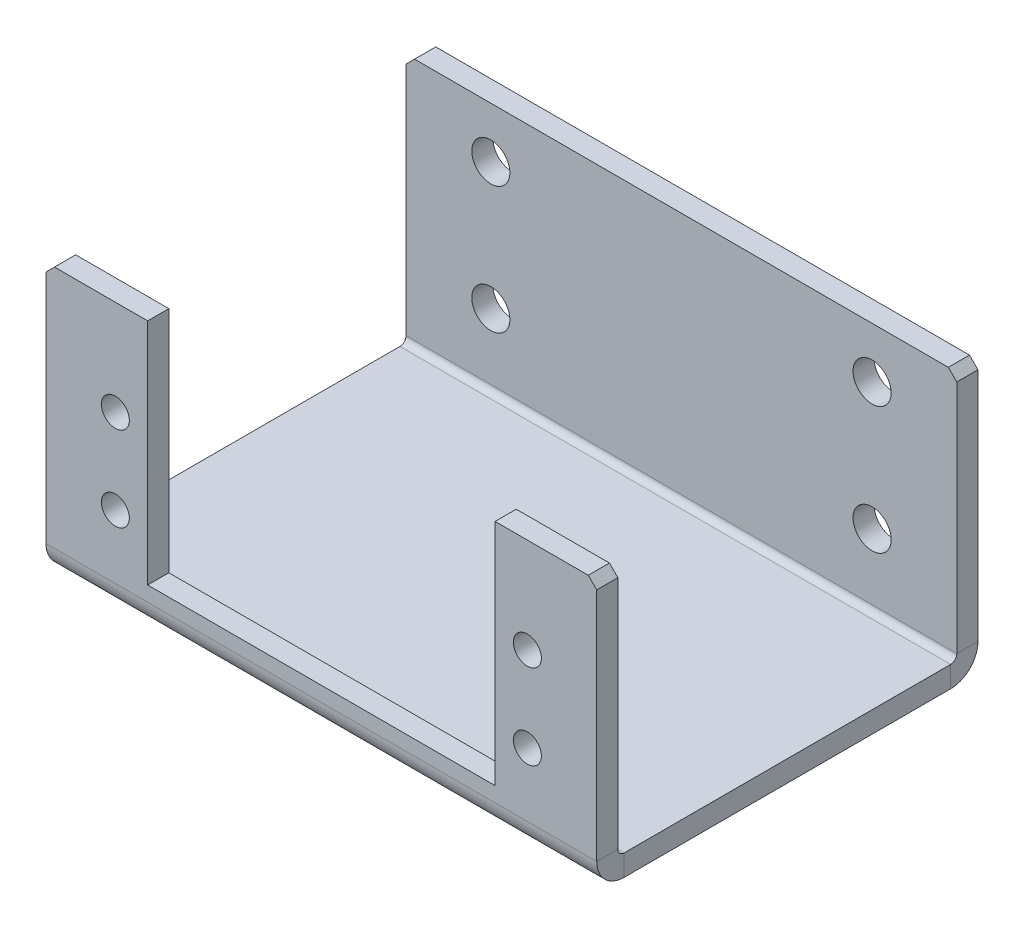
from build123d import *

# Parameters (mm, degrees)
SM_BASE_FLANGE_1_DEPTH      = 32.5
HOLE_WIZARD_M4_1_D          = 3.3
HOLE_WIZARD_M4_1_DEPTH      = 11.5
HOLE_WIZARD_M4_1_TIP        = 0.991420021
OTHER_START                 = -32.5
OTHER_1_DEPTH               = 65
OTHER_1_2_DEPTH             = 65
CUT_EXTRUDE_1_REACH         = 79.484
SKETCH_11_W                 = 41
SKETCH_11_H                 = 27
OTHER_1_3_DEPTH             = 65
OTHER_1_3_2_DEPTH           = 65
HOLE_WIZARD_4_5_4_5_1_D     = 4.5
HOLE_WIZARD_4_5_4_5_1_DEPTH = 2.5
CHAMFER_1_SIZE              = 1


# Read off the part's stored shape, not the designer's step: 展开1, 折叠1
# Sheet-metal steps are written as plain solids
with BuildPart() as part:
    # Sketch 1 → 基体-法兰1 (new, symmetric)
    with BuildSketch(Plane(origin=(0, 0, 0), x_dir=(0, 0, -1), z_dir=(1, 0, 0))):
        with BuildLine():
            Line((-22.5, 32), (-22.5, 3.2366))
            ThreePointArc((-22.5, 3.2366), (-21.552021808, 0.947978192), (-19.2634, 0))
            Line((-19.2634, 0), (19.2634, 0))
            ThreePointArc((19.2634, 0), (21.552021808, 0.947978192), (22.5, 3.2366))
            Line((22.5, 3.2366), (22.5, 32))
            Line((22.5, 32), (20, 32))
            Line((20, 32), (20, 3.2366))
            ThreePointArc((20, 3.2366), (19.784254855, 2.715745145), (19.2634, 2.5))
            Line((19.2634, 2.5), (-19.2634, 2.5))
            ThreePointArc((-19.2634, 2.5), (-19.784254855, 2.715745145), (-20, 3.2366))
            Line((-20, 3.2366), (-20, 32))
            Line((-20, 32), (-22.5, 32))
        make_face()
    extrude(amount=SM_BASE_FLANGE_1_DEPTH, both=True)

    # M4 螺纹孔1
    with Locations(Plane(origin=(0, 6, 22.5), x_dir=(1, 0, 0), z_dir=(0, 0, 1))):
        with Locations((-24.315, 14.75), (-24.315, 4.75), (24.315, 14.75), (24.315, 4.75)):
            Hole(HOLE_WIZARD_M4_1_D / 2, depth=HOLE_WIZARD_M4_1_DEPTH)
            with Locations((0, 0, -(HOLE_WIZARD_M4_1_DEPTH + HOLE_WIZARD_M4_1_TIP / 2))):  # 118° drill point
                Cone(0, HOLE_WIZARD_M4_1_D / 2, HOLE_WIZARD_M4_1_TIP, mode=Mode.SUBTRACT)

    # Other 1 outline → Other 1 (cut)
    with BuildSketch(Plane.YZ.offset(OTHER_START)):
        with BuildLine():
            Line((3.2366, 20), (0.084933774, 20))
            ThreePointArc((0.084933774, 20), (0.021303554, 19.634140241), (0, 19.2634))
            Line((0, 19.2634), (0, -19.2634))
            ThreePointArc((0, -19.2634), (0.947978192, -21.552021808), (3.2366, -22.5))
            Line((3.2366, -22.5), (32, -22.5))
            Line((32, -22.5), (32, -20))
            Line((32, -20), (3.2366, -20))
            ThreePointArc((3.2366, -20), (2.715745145, -19.784254855), (2.5, -19.2634))
            Line((2.5, -19.2634), (2.5, 19.2634))
            ThreePointArc((2.5, 19.2634), (2.715745145, 19.784254855), (3.2366, 20))
        make_face()
    extrude(amount=OTHER_1_DEPTH, mode=Mode.SUBTRACT)

    # Other 1 2 outline → Other 1 2 (add)
    with BuildSketch(Plane.YZ.offset(OTHER_START)):
        with BuildLine():
            Line((3.2366, 22.5), (-70.294687966, 22.5))
            Line((-70.294687966, 22.5), (-70.294687966, 20))
            Line((-70.294687966, 20), (0.084933774, 20))
            ThreePointArc((0.084933774, 20), (1.225195018, 21.799110859), (3.2366, 22.5))
        make_face()
    extrude(amount=OTHER_1_2_DEPTH)

    # 草图11 → 切除-拉伸1 (cut, up to next)
    with BuildSketch(Plane(origin=(0, 0, 20), x_dir=(-1, 0, 0), z_dir=(0, 0, -1)), mode=Mode.PRIVATE) as cut_extrude_1_sk1:
        with Locations((0, 18.5)):
            Rectangle(SKETCH_11_W, SKETCH_11_H)
    cut_extrude_1_tool1 = extrude(cut_extrude_1_sk1.sketch, amount=-CUT_EXTRUDE_1_REACH, mode=Mode.PRIVATE) & part.part
    add(cut_extrude_1_tool1.solids().sort_by_distance((0, 18.5, 20))[0], mode=Mode.SUBTRACT)

    # Other 1 3 outline → Other 1 3 (cut)
    with BuildSketch(Plane.YZ.offset(OTHER_START)):
        with BuildLine():
            Line((-70.294687966, 20), (0.084933774, 20))
            ThreePointArc((0.084933774, 20), (1.225195018, 21.799110859), (3.2366, 22.5))
            Line((3.2366, 22.5), (-70.294687966, 22.5))
            Line((-70.294687966, 22.5), (-70.294687966, 20))
        make_face()
    extrude(amount=OTHER_1_3_DEPTH, mode=Mode.SUBTRACT)

    # Other 1 3 2 outline → Other 1 3 2 (add)
    with BuildSketch(Plane.YZ.offset(OTHER_START)):
        with BuildLine():
            ThreePointArc((0.084933774, 20), (0.021303554, 19.634140241), (0, 19.2634))
            Line((0, 19.2634), (0, -19.2634))
            ThreePointArc((0, -19.2634), (0.947978192, -21.552021808), (3.2366, -22.5))
            Line((3.2366, -22.5), (32, -22.5))
            Line((32, -22.5), (32, -20))
            Line((32, -20), (3.2366, -20))
            ThreePointArc((3.2366, -20), (2.715745145, -19.784254855), (2.5, -19.2634))
            Line((2.5, -19.2634), (2.5, 19.2634))
            ThreePointArc((2.5, 19.2634), (2.715745145, 19.784254855), (3.2366, 20))
            Line((3.2366, 20), (0.084933774, 20))
        make_face()
    extrude(amount=OTHER_1_3_2_DEPTH)

    # Ø4.5 (4.5) 直径孔1
    with Locations(Plane(origin=(0, 0, -22.5), x_dir=(-1, 0, 0), z_dir=(0, 0, -1))):
        with Locations((-22.5, 26), (-22.5, 11), (22.5, 26), (22.5, 11)):
            Hole(HOLE_WIZARD_4_5_4_5_1_D / 2, depth=HOLE_WIZARD_4_5_4_5_1_DEPTH)

    # 倒角1
    chamfer_1_edges = [part.edges().sort_by_distance(p)[0] for p in [
        (32.5, 32, 21.25),
        (-32.5, 32, 21.25),
        (32.5, 32, -21.25),
        (-32.5, 32, -21.25),
    ]]
    chamfer(chamfer_1_edges, length=CHAMFER_1_SIZE)


solid = part.part
